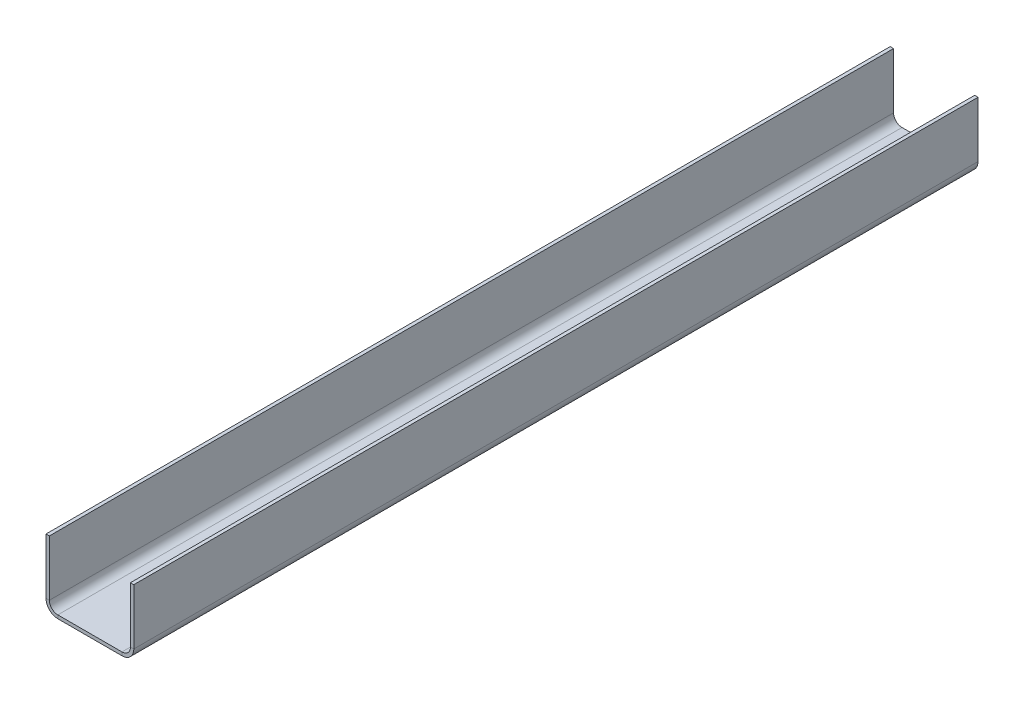
from build123d import *

# Parameters (mm, degrees)
TABAN_FLAN_1_DEPTH = 2500


# Sheet-metal steps are written as plain solids
with BuildPart() as part:
    # Çizim1 → Taban-Flanş1 (new body)
    with BuildSketch(Plane.XY):
        with BuildLine():
            Line((0, 0), (0, -165))
            ThreePointArc((0, -165), (7.32233047, -182.67766953), (25, -190))
            Line((25, -190), (215, -190))
            ThreePointArc((215, -190), (232.67766953, -182.67766953), (240, -165))
            Line((240, -165), (240, 0))
            Line((240, 0), (250, 0))
            Line((250, 0), (250, -165))
            ThreePointArc((250, -165), (239.748737342, -189.748737342), (215, -200))
            Line((215, -200), (25, -200))
            ThreePointArc((25, -200), (0.251262658, -189.748737342), (-10, -165))
            Line((-10, -165), (-10, 0))
            Line((-10, 0), (0, 0))
        make_face()
    extrude(amount=TABAN_FLAN_1_DEPTH)


solid = part.part
